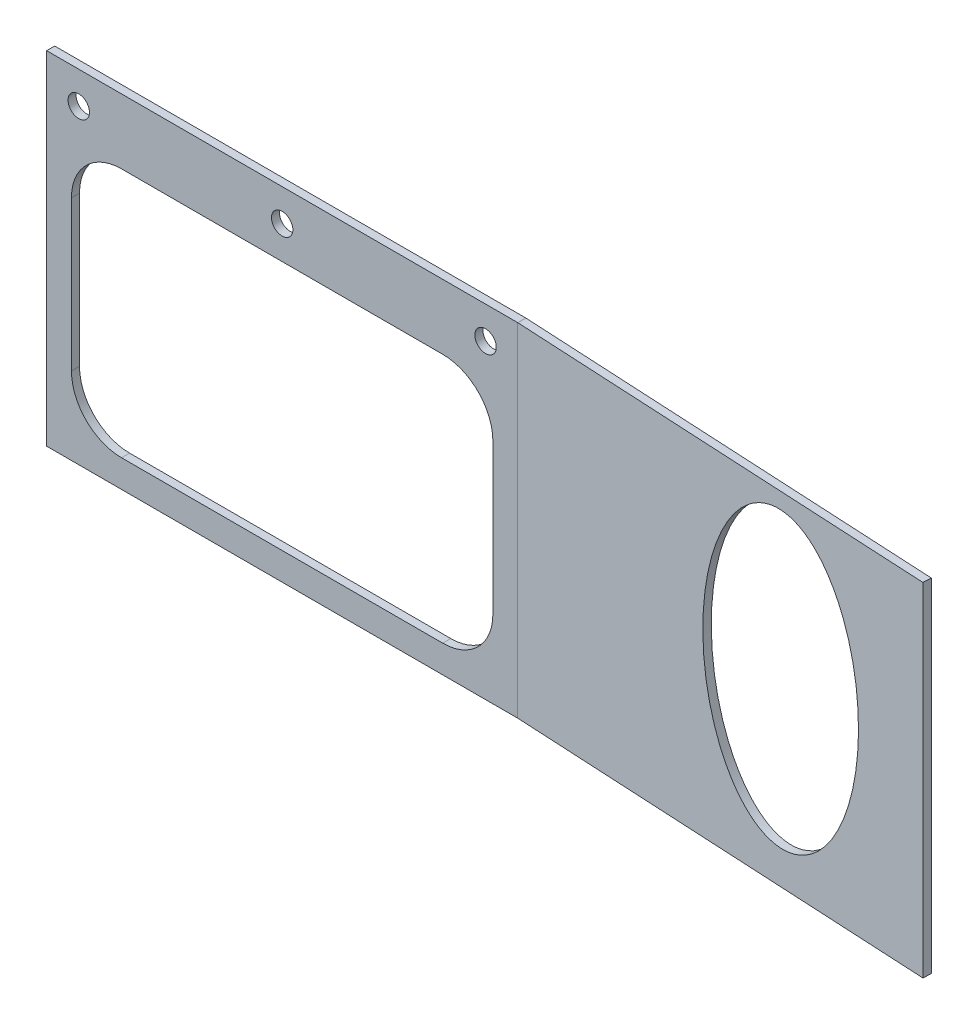
from build123d import *

# Parameters (mm, degrees)
SKETCH1_W                    = 4.7752
SKETCH1_H                    = 203.2
BASE_FLANGE1_DEPTH           = 279.4
SKETCH2_R                    = 6.35
CUT_EXTRUDE1_DEPTH           = 10.16
CUT_EXTRUDE2_DEPTH           = 4.7752
EDGE_FLANGE2_STRIP_CUT_DEPTH = 203.2
EDGE_FLANGE2_DEPTH           = 203.2
SKETCH19_RX                  = 86.8934
SKETCH19_RY                  = 48.7934
CUT_EXTRUDE3_DEPTH           = 127


# Sheet-metal steps are written as plain solids
with BuildPart() as part:
    # Sketch1 → Base-Flange1 (new body)
    with BuildSketch(Plane(origin=(0, 0, 0), x_dir=(0, 0, -1), z_dir=(1, 0, 0))):
        with Locations((2.3876, 101.6)):
            Rectangle(SKETCH1_W, SKETCH1_H)
    extrude(amount=-BASE_FLANGE1_DEPTH)

    # Sketch2 → Cut-Extrude1 (cut)
    with BuildSketch(Plane(origin=(0, 0, -4.7752), x_dir=(-1, 0, 0), z_dir=(0, 0, -1))):
        with Locations((19.05, 184.15)):
            Circle(SKETCH2_R)
        with Locations((139.7, 184.15)):
            Circle(SKETCH2_R)
        with Locations((260.35, 184.15)):
            Circle(SKETCH2_R)
    extrude(amount=-CUT_EXTRUDE1_DEPTH, mode=Mode.SUBTRACT)

    # Sketch3 → Cut-Extrude2 (cut)
    with BuildSketch(Plane(origin=(0, 0, -4.7752), x_dir=(-1, 0, 0), z_dir=(0, 0, -1))):
        with BuildLine():
            Line((14.7066, 134.9375), (14.7066, 46.0375))
            ThreePointArc((14.7066, 46.0375), (23.418240164, 25.005740164), (44.45, 16.2941))
            Line((44.45, 16.2941), (234.95, 16.2941))
            ThreePointArc((234.95, 16.2941), (255.981759836, 25.005740164), (264.6934, 46.0375))
            Line((264.6934, 46.0375), (264.6934, 134.9375))
            ThreePointArc((264.6934, 134.9375), (255.981759836, 155.969259836), (234.95, 164.6809))
            Line((234.95, 164.6809), (44.45, 164.6809))
            ThreePointArc((44.45, 164.6809), (23.418240164, 155.969259836), (14.7066, 134.9375))
        make_face()
        with BuildLine():
            Line((44.45, 153.9875), (234.95, 153.9875))
            ThreePointArc((234.95, 153.9875), (248.420384182, 148.407884182), (254, 134.9375))
            Line((254, 134.9375), (254, 46.0375))
            ThreePointArc((254, 46.0375), (248.420384182, 32.567115818), (234.95, 26.9875))
            Line((234.95, 26.9875), (44.45, 26.9875))
            ThreePointArc((44.45, 26.9875), (30.979615818, 32.567115818), (25.4, 46.0375))
            Line((25.4, 46.0375), (25.4, 134.9375))
            ThreePointArc((25.4, 134.9375), (30.979615818, 148.407884182), (44.45, 153.9875))
        make_face(mode=Mode.SUBTRACT)
    extrude(amount=-CUT_EXTRUDE2_DEPTH, mode=Mode.SUBTRACT)


with BuildPart() as cut_extrude2_kept_piece:
    # of the separate pieces the step leaves, the one the design keeps (cut_extrude2_pieces_kept)
    add(part.part.solids().sort_by_distance((0, 0, 0))[0])

    # Edge-Flange2 strip (across the edge) → Edge-Flange2 strip cut (cut)
    with BuildSketch(Plane(origin=(0, 0, 0), x_dir=(-0.052335956242937604, 0, 0.9986295347545743), z_dir=(0, 1, 0))):
        Polygon((-5.794552955, 19.325370054), (-4.768307656, -0.256556767), (0.000348098, -0.006642109), (-1.025897201, 19.575284712), align=None)
    extrude(amount=EDGE_FLANGE2_STRIP_CUT_DEPTH, mode=Mode.SUBTRACT)

    # Edge-Flange2 section (across the edge) → Edge-Flange2 (add)
    with BuildSketch(Plane(origin=(0, 0, 0), x_dir=(-0.052335956242937604, 0, 0.9986295347545743), z_dir=(0, 1, 0))):
        with BuildLine():
            Line((-4.7752, 0.006651224), (-4.7752, 254))
            Line((-4.7752, 254), (0, 254))
            Line((0, 254), (0, 0.006651224))
            ThreePointArc((0, 0.006651224), (8.7039e-05, 2.279e-06), (0.000348098, -0.006642109))
            Line((0.000348098, -0.006642109), (-4.768307656, -0.256556767))
            ThreePointArc((-4.768307656, -0.256556767), (-4.773476619, -0.124997884), (-4.7752, 0.006651224))
        make_face()
    extrude(amount=EDGE_FLANGE2_DEPTH)

    # Sketch19 → Cut-Extrude3 (cut)
    with BuildSketch(Plane(origin=(0.249914658, 0, -4.768655754), x_dir=(-0.9986295347545743, 0, -0.052335956242937624), z_dir=(0.052335956242937624, 0, -0.9986295347545743))):
        with Locations(Location((-164.843443233, 106.7816), (0, 0, 90))):
            Ellipse(SKETCH19_RX, SKETCH19_RY)
    extrude(amount=-CUT_EXTRUDE3_DEPTH, mode=Mode.SUBTRACT)


solid = cut_extrude2_kept_piece.part
